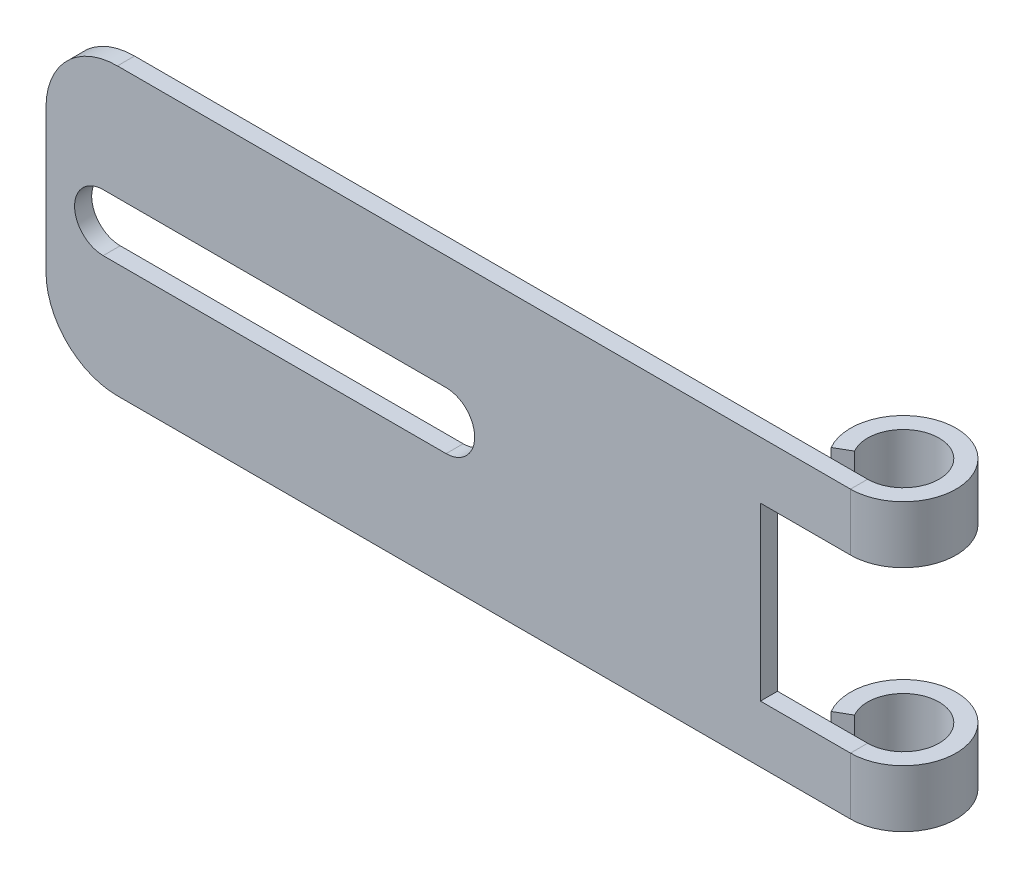
from build123d import *

# Parameters (mm, degrees)
BASE_FLANGE1_DEPTH      = 1.51892
HEM1_START              = -12.7
HEM1_DEPTH              = 25.4
HEM1_2_DEPTH            = 5.08
HEM1_START_2            = 7.62
HEM1_3_DEPTH            = 5.08
CUT_EXTRUDE1_DEPTH      = 42.243563617
CUT_EXTRUDE1_DEPTH_BACK = 42.243563617


# Read off the part's stored shape, not the designer's step: Hem1
# Sheet-metal steps are written as plain solids
with BuildPart() as part:
    # Sketch1 → Base-Flange1 (new body)
    with BuildSketch(Plane.XY):
        with BuildLine():
            Line((38.1, -7.62), (38.1, -12.7))
            Line((38.1, -12.7), (-31.75, -12.7))
            ThreePointArc((-31.75, -12.7), (-36.240128061, -10.840128061), (-38.1, -6.35))
            Line((-38.1, -6.35), (-38.1, 6.35))
            ThreePointArc((-38.1, 6.35), (-36.240128061, 10.840128061), (-31.75, 12.7))
            Line((-31.75, 12.7), (38.1, 12.7))
            Line((38.1, 12.7), (38.1, 7.62))
            Line((38.1, 7.62), (25.4, 7.62))
            Line((25.4, 7.62), (25.4, -7.62))
            Line((25.4, -7.62), (38.1, -7.62))
        make_face()
    extrude(amount=-BASE_FLANGE1_DEPTH)

    # Hem1 outline → Hem1 (cut)
    with BuildSketch(Plane(origin=(0, 0, 0), x_dir=(1, 0, 0), z_dir=(0, 1, 0)).offset(HEM1_START)):
        with BuildLine():
            Line((38.1, 1.51892), (36.863284068, 1.51892))
            ThreePointArc((36.863284068, 1.51892), (35.294159576, 0.396474191), (33.40608, 0))
            Line((33.40608, 0), (38.1, 0))
            Line((38.1, 0), (38.1, 1.51892))
        make_face()
    extrude(amount=HEM1_DEPTH, mode=Mode.SUBTRACT)

    # Hem1 2 outline → Hem1 2 (add)
    with BuildSketch(Plane(origin=(0, 0, 0), x_dir=(1, 0, 0), z_dir=(0, 1, 0)).offset(HEM1_START)):
        with BuildLine():
            Line((29.341026037, 2.34696), (30.656449343, 3.10642))
            ThreePointArc((30.656449343, 3.10642), (34.99358, 7.443550657), (33.40608, 1.51892))
            Line((33.40608, 1.51892), (36.863284068, 1.51892))
            ThreePointArc((36.863284068, 1.51892), (33.919678028, 9.359657029), (29.341026037, 2.34696))
        make_face()
    extrude(amount=HEM1_2_DEPTH)

    # Hem1 3 outline → Hem1 3 (add)
    with BuildSketch(Plane(origin=(0, 0, 0), x_dir=(1, 0, 0), z_dir=(0, 1, 0)).offset(HEM1_START_2)):
        with BuildLine():
            Line((29.341026037, 2.34696), (30.656449343, 3.10642))
            ThreePointArc((30.656449343, 3.10642), (34.99358, 7.443550657), (33.40608, 1.51892))
            Line((33.40608, 1.51892), (36.863284068, 1.51892))
            ThreePointArc((36.863284068, 1.51892), (33.919678028, 9.359657029), (29.341026037, 2.34696))
        make_face()
    extrude(amount=HEM1_3_DEPTH)

    # Sketch8 → Cut-Extrude1 (cut, two sides: drawn at the far end of the back side and taken through both)
    with BuildSketch(Plane.XY.offset(-CUT_EXTRUDE1_DEPTH_BACK)):
        with BuildLine():
            Line((-33.02, 2.54), (-2.54, 2.54))
            ThreePointArc((-2.54, 2.54), (0, 0), (-2.54, -2.54))
            Line((-2.54, -2.54), (-33.02, -2.54))
            ThreePointArc((-33.02, -2.54), (-35.56, 0), (-33.02, 2.54))
        make_face()
    extrude(amount=CUT_EXTRUDE1_DEPTH + CUT_EXTRUDE1_DEPTH_BACK, mode=Mode.SUBTRACT)


solid = part.part
